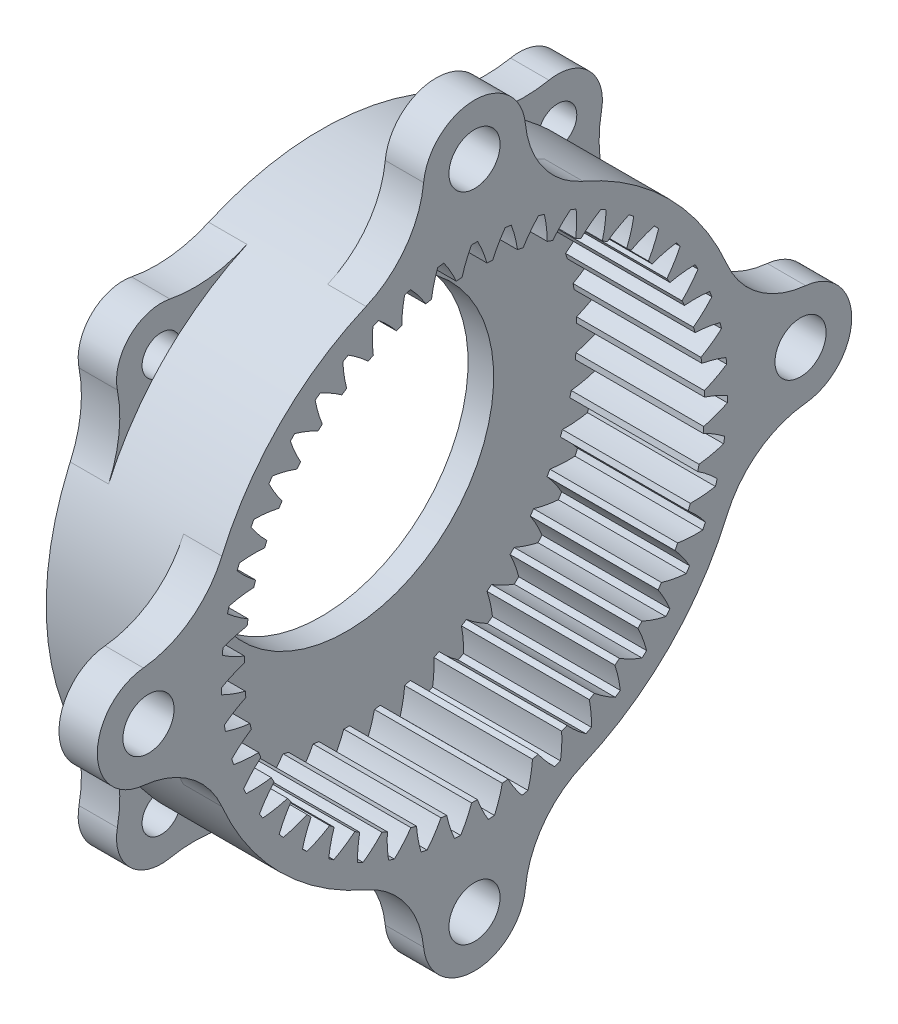
from build123d import *

# Parameters (mm, degrees)
BASPROSKE_W         = 12
BASPROSKE_H         = 3.5
TOOTHCUT_DEPTH      = 33.687918257
TEETHCUTS_COUNT     = 47
TEETHCUTS_ANGLE     = 352.340425532
BOSS_EXTRUDE1_START = -2
SKETCH1_R           = 21.5
BOSS_EXTRUDE1_DEPTH = 2
SKETCH2_R           = 11.5
CUT_EXTRUDE1_DEPTH  = 33.687918257
BOSS_EXTRUDE2_START = -3
BOSS_EXTRUDE2_DEPTH = 3
SKETCH3_R           = 1.5
CUT_EXTRUDE2_DEPTH  = 3
FILLET1_R           = 10
SKETCH6_R           = 2
BOSS_EXTRUDE3_DEPTH = 3
FILLET3_R           = 7.5


with BuildPart() as part:
    # BasProSke → Base-Revolve (revolve)
    with BuildSketch(Plane(origin=(0, 0, 0), x_dir=(1, 0, 0), z_dir=(0, 1, 0)), mode=Mode.PRIVATE) as base_revolve_sk:
        with Locations((6, 19.75)):
            Rectangle(BASPROSKE_W, BASPROSKE_H)
    revolve(base_revolve_sk.sketch.rotate(Axis((-10, 0, 0), (1, 0, 0)), 180), axis=Axis((-10, 0, 0), (1, 0, 0)))

    # TooCutSke → ToothCut (cut, through all)
    with BuildSketch(Plane(origin=(0, 0, 0), x_dir=(0, 0, -1), z_dir=(1, 0, 0))):
        with BuildLine():
            ThreePointArc((0.983195286, 17.947689884), (0.661245829, 18.89336655), (0.240755418, 19.799536303))
            ThreePointArc((0.240755418, 19.799536303), (0, 19.801), (-0.240755418, 19.799536303))
            ThreePointArc((-0.240755418, 19.799536303), (-0.661245829, 18.89336655), (-0.983195286, 17.947689884))
            ThreePointArc((-0.983195286, 17.947689884), (0, 17.9746), (0.983195286, 17.947689884))
        make_face()
    toothcut = extrude(amount=TOOTHCUT_DEPTH, mode=Mode.SUBTRACT)

    # TeethCuts: ToothCut ×47 about axis
    teethcuts_axis = Axis((-10, 0, 0), (1, 0, 0))
    for i in range(1, TEETHCUTS_COUNT):
        add(toothcut.rotate(teethcuts_axis, i * TEETHCUTS_ANGLE / (TEETHCUTS_COUNT - 1)), mode=Mode.SUBTRACT)

    # Sketch1 → Boss-Extrude1 (add)
    with BuildSketch(Plane.ZY.offset(BOSS_EXTRUDE1_START)):
        Circle(SKETCH1_R)
    extrude(amount=BOSS_EXTRUDE1_DEPTH)

    # Sketch2 → Cut-Extrude1 (cut, through all)
    with BuildSketch(Plane.ZY):
        Circle(SKETCH2_R)
    extrude(amount=-CUT_EXTRUDE1_DEPTH, mode=Mode.SUBTRACT)

    # Sketch4 → Boss-Extrude2 (add)
    with BuildSketch(Plane.ZY.offset(BOSS_EXTRUDE2_START)):
        with BuildLine():
            Line((-13.025126266, 17.974873734), (-12.525126266, 17.474873734))
            ThreePointArc((-12.525126266, 17.474873734), (-15.202795796, 15.202795796), (-17.474873734, 12.525126266))
            Line((-17.474873734, 12.525126266), (-17.974873734, 13.025126266))
            ThreePointArc((-17.974873734, 13.025126266), (-17.974873734, 17.974873734), (-13.025126266, 17.974873734))
        make_face()
        with BuildLine():
            Line((17.974873734, 13.025126266), (17.474873734, 12.525126266))
            ThreePointArc((17.474873734, 12.525126266), (15.202795796, 15.202795796), (12.525126266, 17.474873734))
            Line((12.525126266, 17.474873734), (13.025126266, 17.974873734))
            ThreePointArc((13.025126266, 17.974873734), (17.974873734, 17.974873734), (17.974873734, 13.025126266))
        make_face()
        with BuildLine():
            Line((17.474873734, -12.525126266), (17.974873734, -13.025126266))
            ThreePointArc((17.974873734, -13.025126266), (17.974873734, -17.974873734), (13.025126266, -17.974873734))
            Line((13.025126266, -17.974873734), (12.525126266, -17.474873734))
            ThreePointArc((12.525126266, -17.474873734), (15.202795796, -15.202795796), (17.474873734, -12.525126266))
        make_face()
        with BuildLine():
            Line((-12.525126266, -17.474873734), (-13.025126266, -17.974873734))
            ThreePointArc((-13.025126266, -17.974873734), (-17.974873734, -17.974873734), (-17.974873734, -13.025126266))
            Line((-17.974873734, -13.025126266), (-17.474873734, -12.525126266))
            ThreePointArc((-17.474873734, -12.525126266), (-15.202795796, -15.202795796), (-12.525126266, -17.474873734))
        make_face()
    extrude(amount=BOSS_EXTRUDE2_DEPTH)

    # Sketch3 → Cut-Extrude2 (cut)
    with BuildSketch(Plane.ZY):
        with Locations((-15.5, 15.5)):
            Circle(SKETCH3_R)
        with Locations((15.5, 15.5)):
            Circle(SKETCH3_R)
        with Locations((15.5, -15.5)):
            Circle(SKETCH3_R)
        with Locations((-15.5, -15.5)):
            Circle(SKETCH3_R)
    extrude(amount=-CUT_EXTRUDE2_DEPTH, mode=Mode.SUBTRACT)

    # Fillet1
    # the kernel refuses this fillet: 10 mm, written as the material it adds along each edge
    with BuildSketch(Plane(origin=(3, 12.525126266, 17.474873734), x_dir=(0, -0.8670026892811599, 0.4983034585262647), z_dir=(-1, 0, 0)), Plane(origin=(3, -17.474873734, 12.525126266), x_dir=(0, -0.4983034585262629, -0.8670026892811608), z_dir=(-1, 0, 0)), Plane(origin=(3, -12.525126266, -17.474873734), x_dir=(0, 0.8670026892811614, -0.498303458526262), z_dir=(-1, 0, 0)), Plane(origin=(3, 17.474873734, -12.525126266), x_dir=(0, 0.4983034585262626, 0.8670026892811608), z_dir=(-1, 0, 0))) as fillet1_piece_1:
        with BuildLine():
            CenterArc((5.303767035, 9.949802911), FILLET1_R, 228.942164258, 35.314572371)
            Line((-1.264438131, 2.409333371), (-1.921258648, 1.655286417))
            ThreePointArc((-1.921258648, 1.655286417), (-1.149766851, 0.421943348), (-0.965417236, -0.260709726))
            Line((-0.965417236, -0.260709726), (0.100071076, -0.994980291))
            ThreePointArc((0.100071076, -0.994980291), (2.151528137, -0.892076259), (4.202985198, -0.994980291))
            Line((4.202985198, -0.994980291), (4.303056274, 0))
        make_face()
    extrude(amount=3)
    with BuildSketch(Plane(origin=(3, -12.525126266, 17.474873734), x_dir=(0, 0.8670026892811603, 0.49830345852626395), z_dir=(-1, 0, 0)), Plane(origin=(3, -17.474873734, -12.525126266), x_dir=(0, -0.49830345852626085, 0.8670026892811619), z_dir=(-1, 0, 0)), Plane(origin=(3, 12.525126266, -17.474873734), x_dir=(0, -0.8670026892811614, -0.4983034585262618), z_dir=(-1, 0, 0)), Plane(origin=(3, 17.474873734, 12.525126266), x_dir=(0, 0.4983034585262623, -0.8670026892811611), z_dir=(-1, 0, 0))) as fillet1_piece_2:
        with BuildLine():
            CenterArc((5.303767035, -9.949802911), FILLET1_R, 95.743263371, 35.314572371)
            Line((-1.264438131, -2.409333371), (-1.921258648, -1.655286417))
            ThreePointArc((-1.921258648, -1.655286417), (-1.149766851, -0.421943348), (-0.965417236, 0.260709726))
            Line((-0.965417236, 0.260709726), (0.100071076, 0.994980291))
            ThreePointArc((0.100071076, 0.994980291), (2.151528137, 0.892076259), (4.202985198, 0.994980291))
            Line((4.202985198, 0.994980291), (4.303056274, 0))
        make_face()
    extrude(amount=3)

    # Sketch6 → Boss-Extrude3 (add)
    # profile 1 of 4: a face of its own
    with BuildSketch(Plane(origin=(12, 0, 0), x_dir=(0, 0, -1), z_dir=(1, 0, 0))):
        with BuildLine():
            Line((-20.134497303, 4), (-25.5, 4))
            ThreePointArc((-25.5, 4), (-29.5, 0), (-25.5, -4))
            Line((-25.5, -4), (-20.134497303, -4))
            Line((-20.134497303, -4), (-20.134497303, 4))
        make_face()
        with Locations((-25.5, 0)):
            Circle(SKETCH6_R, mode=Mode.SUBTRACT)
    # profile 2 of 4: a face of its own
    with BuildSketch(Plane(origin=(12, 0, 0), x_dir=(0, 0, -1), z_dir=(1, 0, 0))):
        with BuildLine():
            Line((4, 20.134497303), (4, 25.5))
            ThreePointArc((4, 25.5), (0, 29.5), (-4, 25.5))
            Line((-4, 25.5), (-4, 20.134497303))
            Line((-4, 20.134497303), (4, 20.134497303))
        make_face()
        with Locations((0, 25.5)):
            Circle(SKETCH6_R, mode=Mode.SUBTRACT)
    # profile 3 of 4: a face of its own
    with BuildSketch(Plane(origin=(12, 0, 0), x_dir=(0, 0, -1), z_dir=(1, 0, 0))):
        with BuildLine():
            Line((20.134497303, -4), (25.5, -4))
            ThreePointArc((25.5, -4), (29.5, 0), (25.5, 4))
            Line((25.5, 4), (20.134497303, 4))
            Line((20.134497303, 4), (20.134497303, -4))
        make_face()
        with Locations((25.5, 0)):
            Circle(SKETCH6_R, mode=Mode.SUBTRACT)
    # profile 4 of 4: a face of its own
    with BuildSketch(Plane(origin=(12, 0, 0), x_dir=(0, 0, -1), z_dir=(1, 0, 0))):
        with BuildLine():
            Line((-4, -20.134497303), (-4, -25.5))
            ThreePointArc((-4, -25.5), (0, -29.5), (4, -25.5))
            Line((4, -25.5), (4, -20.134497303))
            Line((4, -20.134497303), (-4, -20.134497303))
        make_face()
        with Locations((0, -25.5)):
            Circle(SKETCH6_R, mode=Mode.SUBTRACT)
    extrude(amount=-BOSS_EXTRUDE3_DEPTH)

    # Fillet3
    # the kernel refuses this fillet: 7.5 mm, written as the material it adds along each edge
    with BuildSketch(Plane(origin=(9, 4, 21.124630174), x_dir=(0, 0.9564027513849028, -0.29205098380828587), z_dir=(1, 0, 0)), Plane(origin=(9, 21.124630174, -4), x_dir=(0, -0.29205098380826866, -0.9564027513849082), z_dir=(1, 0, 0)), Plane(origin=(9, -4, -21.124630174), x_dir=(0, -0.9564027513849175, 0.2920509838082375), z_dir=(1, 0, 0)), Plane(origin=(9, -21.124630174, 4), x_dir=(0, 0.2920509838082546, 0.9564027513849124), z_dir=(1, 0, 0))) as fillet3_piece_1:
        with BuildLine():
            CenterArc((5.505340929, 7.455299426), FILLET3_R, 202.705228593, 61.036138422)
            Line((-1.41343059, 4.560372716), (-2.105307742, 4.270880045))
            ThreePointArc((-2.105307742, 4.270880045), (-1.995133126, 3.965577502), (-0.717302064, -0.219038238))
            Line((-0.717302064, -0.219038238), (0.081762489, -0.745529943))
            ThreePointArc((0.081762489, -0.745529943), (2.343858019, -0.621858356), (4.60595355, -0.745529943))
            Line((4.60595355, -0.745529943), (4.687716039, 0))
        make_face()
    extrude(amount=3)
    with BuildSketch(Plane(origin=(9, 21.124630174, 4), x_dir=(0, -0.29205098380830635, 0.9564027513848966), z_dir=(1, 0, 0)), Plane(origin=(9, 4, -21.124630174), x_dir=(0, 0.9564027513848882, 0.29205098380833383), z_dir=(1, 0, 0)), Plane(origin=(9, -21.124630174, -4), x_dir=(0, 0.29205098380831446, -0.9564027513848941), z_dir=(1, 0, 0)), Plane(origin=(9, -4, 21.124630174), x_dir=(0, -0.9564027513849027, -0.2920509838082861), z_dir=(1, 0, 0))) as fillet3_piece_2:
        with BuildLine():
            CenterArc((5.505340929, -7.455299426), FILLET3_R, 96.258632985, 61.036138422)
            Line((-1.41343059, -4.560372716), (-2.105307742, -4.270880045))
            ThreePointArc((-2.105307742, -4.270880045), (-1.995133126, -3.965577502), (-0.717302064, 0.219038238))
            Line((-0.717302064, 0.219038238), (0.081762489, 0.745529943))
            ThreePointArc((0.081762489, 0.745529943), (2.343858019, 0.621858356), (4.60595355, 0.745529943))
            Line((4.60595355, 0.745529943), (4.687716039, 0))
        make_face()
    extrude(amount=3)


solid = part.part
